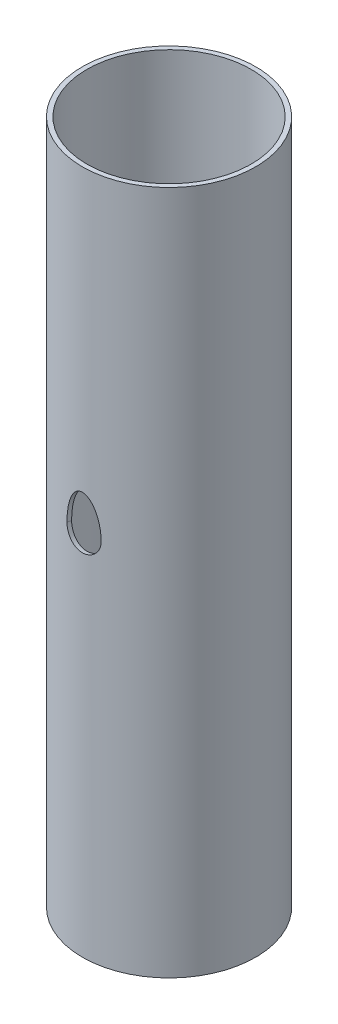
from build123d import *

# Parameters (mm, degrees)
SKETCH2_R           = 38
SKETCH2_R_2         = 36
BOSS_EXTRUDE1_DEPTH = 300
CUT_EXTRUDE1_REACH  = 306.775


with BuildPart() as part:
    # Sketch2 → Boss-Extrude1 (new body)
    with BuildSketch(Plane(origin=(0, 0, 0), x_dir=(1, 0, 0), z_dir=(0, 1, 0))):
        Circle(SKETCH2_R)
        Circle(SKETCH2_R_2, mode=Mode.SUBTRACT)
    extrude(amount=BOSS_EXTRUDE1_DEPTH)

    # Sketch3 → Cut-Extrude1 (cut, up to next)
    with BuildSketch(Plane(origin=(0, 0, 0), x_dir=(-1, 0, 0), z_dir=(0, 0.20449605184179045, 0.978867388761685)), mode=Mode.PRIVATE) as cut_extrude1_sk1:
        with BuildLine():
            ThreePointArc((7.5, -150), (0, -142.5), (-7.5, -150))
            add(Edge.make_bspline(
                [(-7.5, -150), (-7.5, -165), (0, -165), (7.5, -165), (7.5, -150)],
                knots=[4.71238898, 4.71238898, 4.71238898, 6.283185307, 6.283185307, 7.853981634, 7.853981634, 7.853981634], degree=2, weights=[1, 0.707106781, 1, 0.707106781, 1]))
        make_face()
    cut_extrude1_tool1 = extrude(cut_extrude1_sk1.sketch, amount=CUT_EXTRUDE1_REACH, mode=Mode.PRIVATE) & part.part
    add(cut_extrude1_tool1.solids().sort_by_distance((0, 149.944823, -31.325106))[0], mode=Mode.SUBTRACT)


solid = part.part
